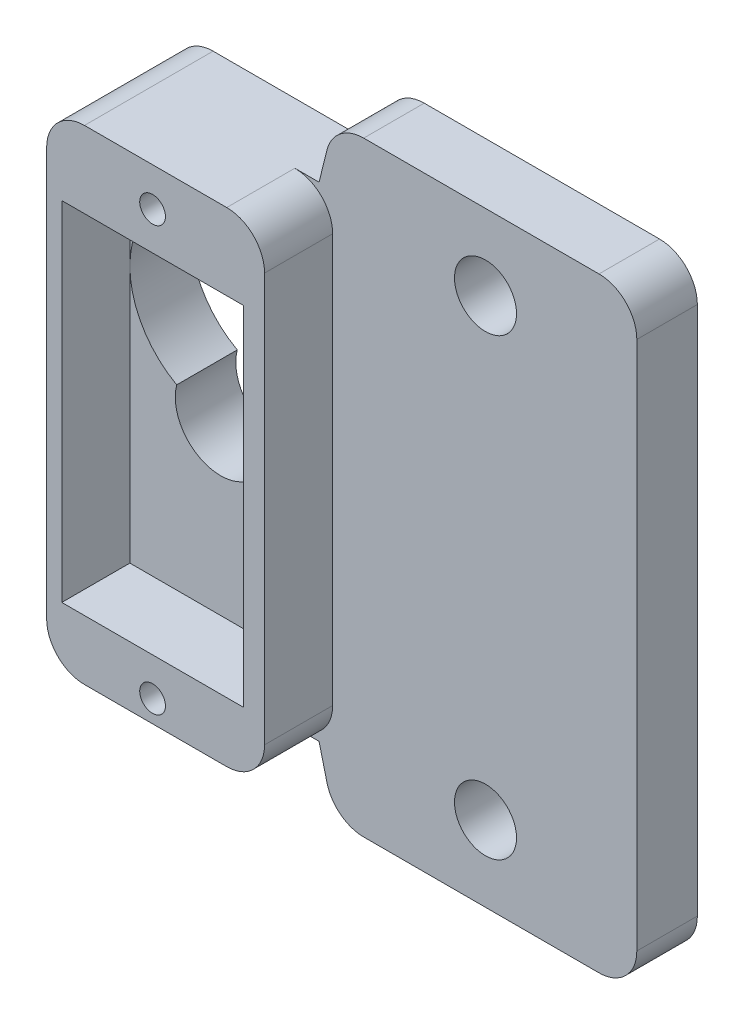
from build123d import *

# Parameters (mm, degrees)
ESQUISSE1_R             = 2.05
BOSS_EXTRU_1_DEPTH      = 4
BOSS_EXTRU_2_DEPTH      = 4.5
ESQUISSE3_R             = 0.85
ENL_V_MAT_EXTRU_1_DEPTH = 8
CONG_1_R                = 2.5


with BuildPart() as part:
    # Esquisse1 → Boss.-Extru.1 (new body)
    with BuildSketch(Plane.XY):
        Polygon((20, 20), (0, 20), (-1, 16), (-14.5, 16), (-14.5, -16), (-1, -16), (0, -20), (20, -20), align=None)
        with Locations((10, -15)):
            Circle(ESQUISSE1_R, mode=Mode.SUBTRACT)
        with BuildLine():
            ThreePointArc((-4.59526249, -0.3), (-7.5, -4.05), (-10.40473751, -0.3))
            ThreePointArc((-10.40473751, -0.3), (-7.5, 10.95), (-4.59526249, -0.3))
        make_face(mode=Mode.SUBTRACT)
        with Locations((10, 15)):
            Circle(ESQUISSE1_R, mode=Mode.SUBTRACT)
    extrude(amount=BOSS_EXTRU_1_DEPTH)

    # Esquisse2 → Boss.-Extru.2 (add)
    with BuildSketch(Plane.XY.offset(4)):
        with BuildLine():
            Line((-0.1, -13.5), (-0.1, 13.5))
            ThreePointArc((-0.1, 13.5), (-0.832233047, 15.267766953), (-2.6, 16))
            Line((-2.6, 16), (-14.5, 16))
            Line((-14.5, 16), (-14.5, -16))
            Line((-14.5, -16), (-2.6, -16))
            ThreePointArc((-2.6, -16), (-0.832233047, -15.267766953), (-0.1, -13.5))
        make_face()
        Polygon((-1.5, 4.95), (-1.5, -12.05), (-13.5, -12.05), (-13.5, 4.95), (-13.5, 10.95), (-7.499999909, 10.95), (-1.5, 10.95), align=None, mode=Mode.SUBTRACT)
    extrude(amount=BOSS_EXTRU_2_DEPTH)

    # Esquisse3 → Enlèv. mat.-Extru.1 (cut)
    with BuildSketch(Plane.XY.offset(8.5)):
        with Locations((-7.5, 13.45)):
            Circle(ESQUISSE3_R)
        with Locations((-7.5, -14.55)):
            Circle(ESQUISSE3_R)
    extrude(amount=-ENL_V_MAT_EXTRU_1_DEPTH, mode=Mode.SUBTRACT)

    # Congé1
    cong_1_edges = [part.edges().sort_by_distance(p)[0] for p in [
        (20, 20, 2),
        (20, -20, 2),
        (0, 20, 2),
        (0, -20, 2),
        (-14.5, -16, 4.25),
        (-14.5, 16, 4.25),
    ]]
    fillet(cong_1_edges, radius=CONG_1_R)


solid = part.part
